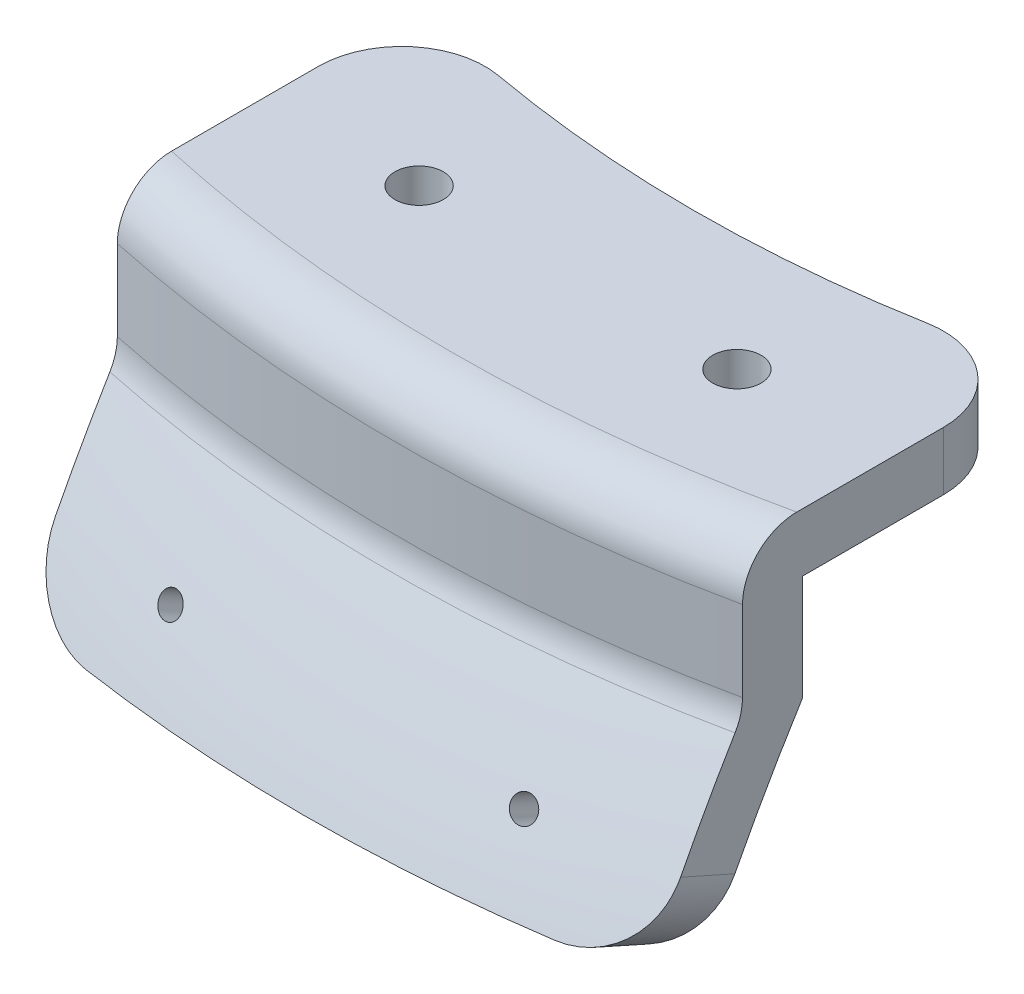
from build123d import *

# Parameters (mm, degrees)
REVOLVE1_ANGLE      = 30
FILLET1_R           = 6.35
SKETCH3_R           = 2.9
CUT_EXTRUDE1_DEPTH  = 203.397131237
SKETCH4_OUTSIDE_W   = 125.116
SKETCH4_OUTSIDE_H   = 77.698
SKETCH4_OUTSIDE_W_2 = 74.947346354
SKETCH4_OUTSIDE_H_2 = 51.780385927
CUT_EXTRUDE2_DEPTH  = 203.397131237
FILLET2_R           = 10


with BuildPart() as part:
    # Sketch2 → Revolve1 (revolve, symmetric)
    with BuildSketch(Plane(origin=(0, 0, 0), x_dir=(0, 0, -1), z_dir=(1, 0, 0))) as revolve1_sk:
        with BuildLine():
            Line((-173.362154908, 191.568849687), (-173.362154908, 178.868849687))
            ThreePointArc((-173.362154908, 178.868849687), (-179.65986055, 167.804357922), (-185.252314728, 156.367202217))
            Line((-185.252314728, 156.367202217), (-191.634038168, 159.24358987))
            ThreePointArc((-191.634038168, 159.24358987), (-186.310738836, 170.195769138), (-180.362154908, 180.821308924))
            Line((-180.362154908, 180.821308924), (-180.362154908, 198.568849687))
            Line((-180.362154908, 198.568849687), (-144.787154908, 198.568849687))
            Line((-144.787154908, 198.568849687), (-144.787154908, 191.568849687))
            Line((-144.787154908, 191.568849687), (-173.362154908, 191.568849687))
        make_face()
    revolve(axis=Axis((0, 72.869777778, 0), (0, 1, 0)), revolution_arc=REVOLVE1_ANGLE / 2)
    revolve(revolve1_sk.sketch, axis=Axis((0, 72.869777778, 0), (0, -1, 0)), revolution_arc=REVOLVE1_ANGLE / 2)

    # Fillet1
    fillet1_edges = [part.edges().sort_by_distance(p)[0] for p in [
        (0, 180.821308924, 180.362154908),
        (0, 198.568849687, 180.362154908),
    ]]
    fillet(fillet1_edges, radius=FILLET1_R)

    # Sketch3 → Cut-Extrude1 (cut, through all)
    with BuildSketch(Plane.XZ.offset(-198.568849687)):
        with Locations((19.05, 158.674245572)):
            Circle(SKETCH3_R)
        with Locations((-19.05, 158.674245572)):
            Circle(SKETCH3_R)
    extrude(amount=CUT_EXTRUDE1_DEPTH, mode=Mode.SUBTRACT)

    # Sketch4 outside → Cut-Extrude2 (cut, through all)
    with BuildSketch(Plane(origin=(0, 198.568849687, 0), x_dir=(1, 0, 0), z_dir=(0, 1, 0))):
        with Locations((0, -165.744)):
            Rectangle(SKETCH4_OUTSIDE_W, SKETCH4_OUTSIDE_H)
        with Locations((0, -165.743845205)):
            Rectangle(SKETCH4_OUTSIDE_W_2, SKETCH4_OUTSIDE_H_2, mode=Mode.SUBTRACT)
    extrude(amount=-CUT_EXTRUDE2_DEPTH, mode=Mode.SUBTRACT)

    # Fillet2
    fillet2_edges = [part.edges().sort_by_distance(p)[0] for p in [
        (-37.473673177, 157.804976424, 184.678649796),
        (-37.473673177, 195.068849687, 139.853652241),
        (37.473673177, 195.068849687, 139.853652241),
        (37.473673177, 157.804976424, 184.678649796),
    ]]
    fillet(fillet2_edges, radius=FILLET2_R)

    # Sketch6 → Cut-Revolve1 (revolve, cut)
    with BuildSketch(Plane(origin=(0, 57.850779247, -29.476444299), x_dir=(0, 0.45399049973954475, 0.8910065241883689), z_dir=(0, 0.8910065241883689, -0.45399049973954475))):
        Polygon((209.17640475, 18.300564093), (275.794196508, 24.128865661), (275.663462894, 25.623157708), (209.045671136, 19.79485614), align=None)
    cut_revolve1 = revolve(axis=Axis((18.300564093, 152.814879773, 156.901097039), (0.08715574274766313, 0.45226292882455593, 0.8876159753616075)), mode=Mode.SUBTRACT)

    # Mirror1: Cut-Revolve1 across plane
    add(cut_revolve1.mirror(Plane(origin=(0, 0, 0), x_dir=(0, 0, 1), z_dir=(1, 0, 0))), mode=Mode.SUBTRACT)


solid = part.part
